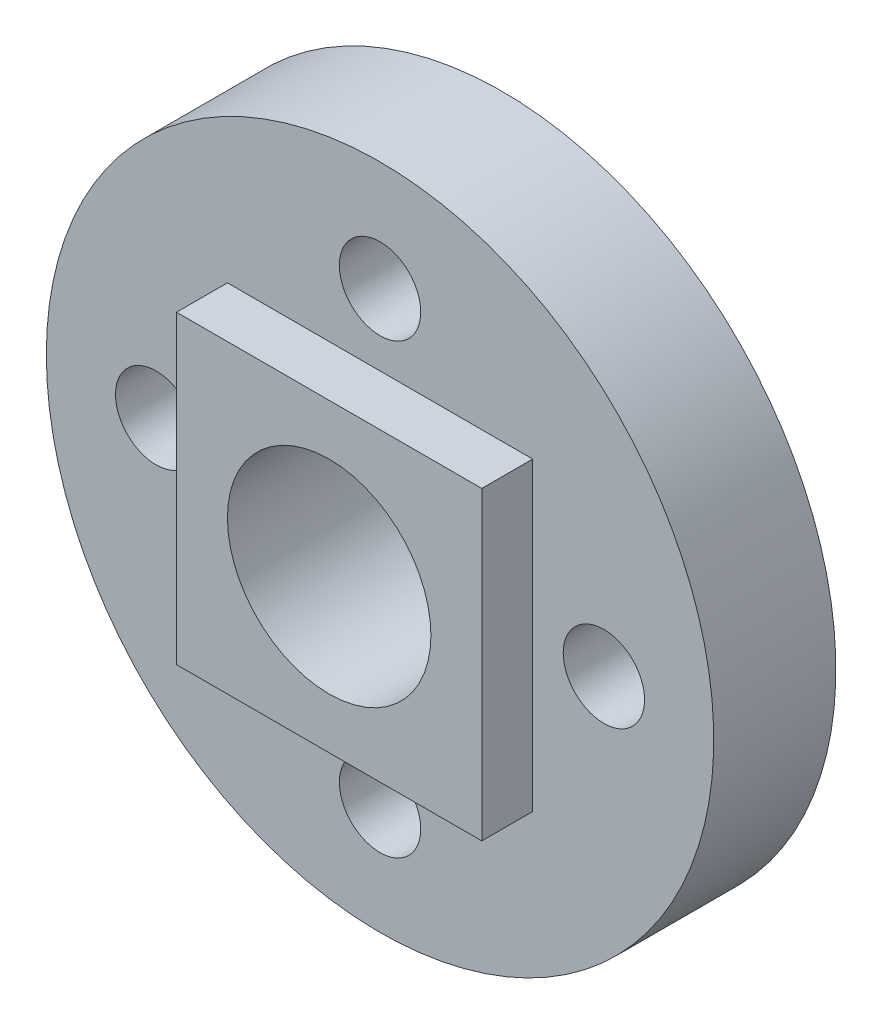
from build123d import *

# Parameters (mm, degrees)
SKETCH2_R           = 20.828
SKETCH2_R_2         = 2.54
SKETCH2_R_3         = 6.35
BOSS_EXTRUDE1_DEPTH = 7.62
SKETCH3_W           = 19.05
SKETCH3_H           = 19.05
SKETCH3_R           = 6.35
BOSS_EXTRUDE2_DEPTH = 3.175


with BuildPart() as part:
    # Sketch2 → Boss-Extrude1 (new body)
    with BuildSketch(Plane.XY):
        Circle(SKETCH2_R)
        with Locations((0, -13.97)):
            Circle(SKETCH2_R_2, mode=Mode.SUBTRACT)
        with Locations((-13.97, 0)):
            Circle(SKETCH2_R_2, mode=Mode.SUBTRACT)
        with Locations((0, 13.97)):
            Circle(SKETCH2_R_2, mode=Mode.SUBTRACT)
        with Locations((13.97, 0)):
            Circle(SKETCH2_R_2, mode=Mode.SUBTRACT)
        Circle(SKETCH2_R_3, mode=Mode.SUBTRACT)
    extrude(amount=BOSS_EXTRUDE1_DEPTH)

    # Sketch3 → Boss-Extrude2 (add)
    with BuildSketch(Plane.XY.offset(7.62)):
        Rectangle(SKETCH3_W, SKETCH3_H)
        Circle(SKETCH3_R, mode=Mode.SUBTRACT)
    extrude(amount=BOSS_EXTRUDE2_DEPTH)


solid = part.part
